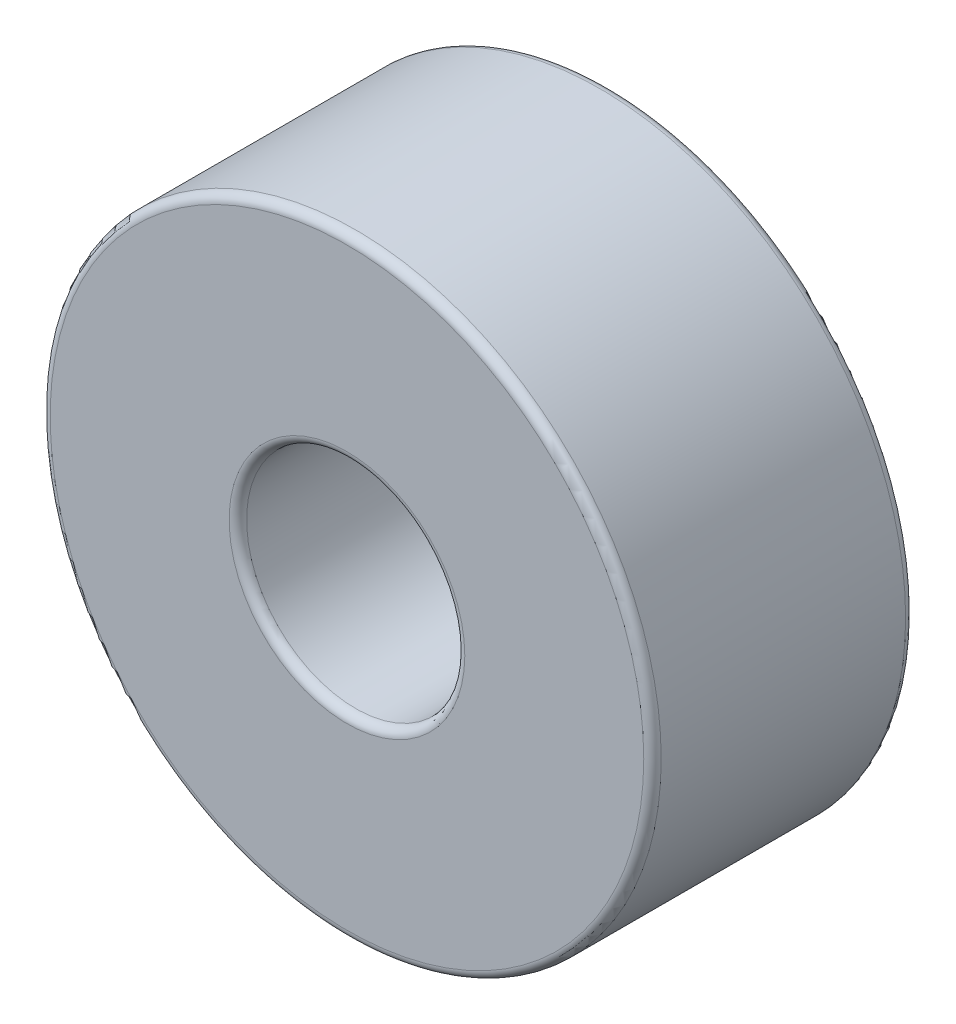
from build123d import *

# Parameters (mm, degrees)
SKETCH_1_R          = 7
EXTRUDE_1_DEPTH     = 6
SKETCH_2_R          = 2.5
CUT_EXTRUDE_1_DEPTH = 12.575836903
FILLET_1_R          = 0.2


with BuildPart() as part:
    # 草图1 → 凸台-拉伸1 (new body)
    with BuildSketch(Plane.XY):
        Circle(SKETCH_1_R)
    extrude(amount=EXTRUDE_1_DEPTH)

    # 草图2 → 切除-拉伸1 (cut, through all)
    with BuildSketch(Plane.XY.offset(6)):
        Circle(SKETCH_2_R)
    extrude(amount=-CUT_EXTRUDE_1_DEPTH, mode=Mode.SUBTRACT)

    # 圆角1
    fillet_1_edges = [part.edges().sort_by_distance(p)[0] for p in [
        (-2.5, 0, 0),
        (-7, 0, 0),
        (-7, 0, 6),
        (-2.5, 0, 6),
    ]]
    fillet(fillet_1_edges, radius=FILLET_1_R)


solid = part.part
